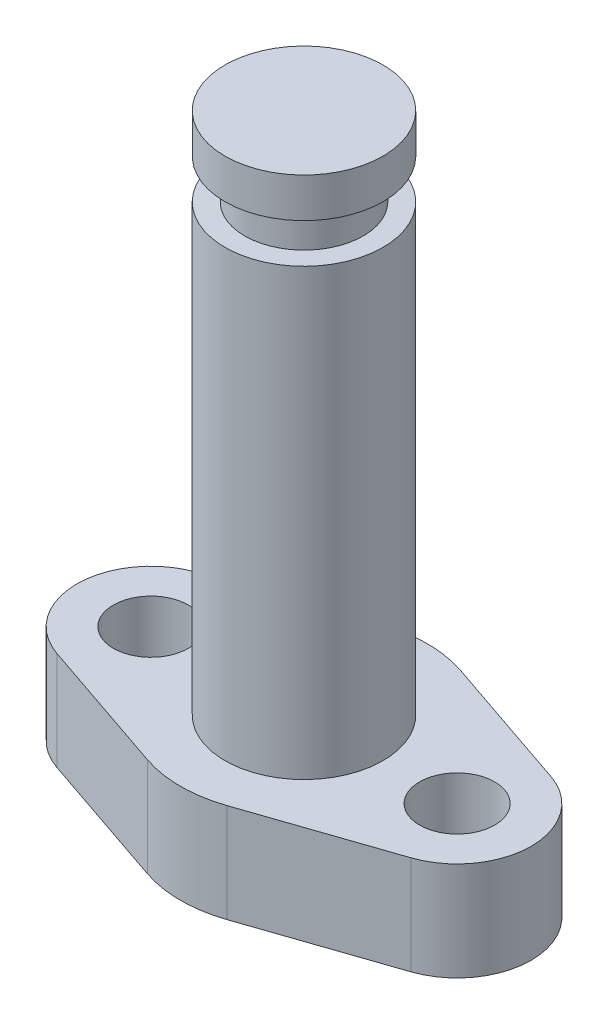
from build123d import *

# Parameters (mm, degrees)
BOSS_EXTRUDE1_DEPTH   = 5
SKETCH2_R             = 4
BOSS_EXTRUDE2_DEPTH   = 22.5
SKETCH3_R             = 3
BOSS_EXTRUDE3_DEPTH   = 2
SKETCH4_R             = 4
BOSS_EXTRUDE4_DEPTH   = 2
F_6_CLEARANCE_HOLE1_D = 3.7973


with BuildPart() as part:
    # Sketch1 → Boss-Extrude1 (new body)
    with BuildSketch(Plane(origin=(0, 0, 0), x_dir=(1, 0, 0), z_dir=(0, 1, 0))):
        with BuildLine():
            ThreePointArc((-8.959677419, 3.54953244), (-11.5, 0), (-8.959677419, -3.54953244))
            Line((-8.959677419, -3.54953244), (-2.016129032, -5.9158874))
            ThreePointArc((-2.016129032, -5.9158874), (0, -6.25), (2.016129032, -5.9158874))
            Line((2.016129032, -5.9158874), (8.959677419, -3.54953244))
            ThreePointArc((8.959677419, -3.54953244), (11.5, 0), (8.959677419, 3.54953244))
            Line((8.959677419, 3.54953244), (2.016129032, 5.9158874))
            ThreePointArc((2.016129032, 5.9158874), (0, 6.25), (-2.016129032, 5.9158874))
            Line((-2.016129032, 5.9158874), (-8.959677419, 3.54953244))
        make_face()
    extrude(amount=BOSS_EXTRUDE1_DEPTH)

    # Sketch2 → Boss-Extrude2 (add)
    with BuildSketch(Plane(origin=(0, 5, 0), x_dir=(1, 0, 0), z_dir=(0, 1, 0))):
        Circle(SKETCH2_R)
    extrude(amount=BOSS_EXTRUDE2_DEPTH)

    # Sketch3 → Boss-Extrude3 (add)
    with BuildSketch(Plane(origin=(0, 27.5, 0), x_dir=(1, 0, 0), z_dir=(0, 1, 0))):
        Circle(SKETCH3_R)
    extrude(amount=BOSS_EXTRUDE3_DEPTH)

    # Sketch4 → Boss-Extrude4 (add)
    with BuildSketch(Plane(origin=(0, 29.5, 0), x_dir=(1, 0, 0), z_dir=(0, 1, 0))):
        Circle(SKETCH4_R)
    extrude(amount=BOSS_EXTRUDE4_DEPTH)

    # #6 Clearance Hole1 (through all)
    with Locations(Plane(origin=(0, 5, 0), x_dir=(1, 0, 0), z_dir=(0, 1, 0))):
        with Locations((-7.75, 0), (7.75, 0)):
            Hole(F_6_CLEARANCE_HOLE1_D / 2)


solid = part.part
